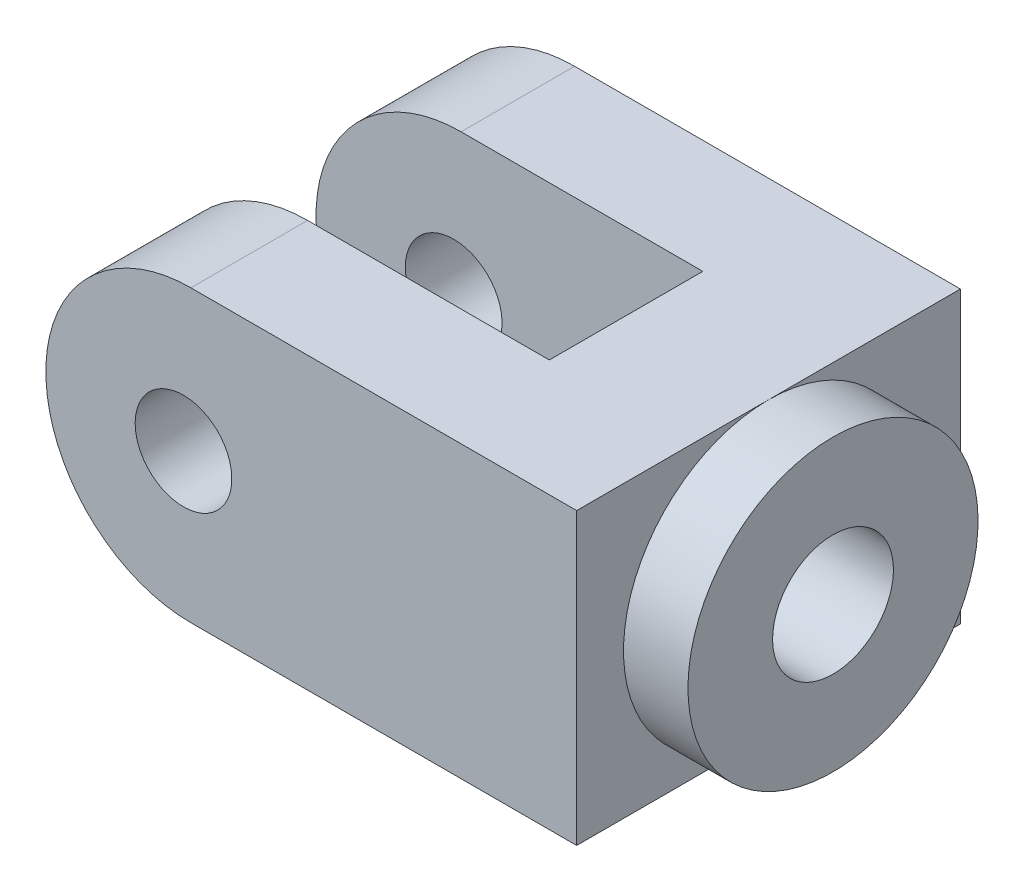
from build123d import *

# Parameters (mm, degrees)
SKETCH1_W           = 132
SKETCH1_H           = 72
BOSS_EXTRUDE1_DEPTH = 47.625
CUT_EXTRUDE1_START  = -95.25
CUT_EXTRUDE1_DEPTH  = 95.25
SKETCH3_W           = 96
SKETCH3_H           = 38.1
CUT_EXTRUDE2_DEPTH  = 109.665268715
SKETCH4_R           = 15
CUT_EXTRUDE3_DEPTH  = 145.656822687
BOSS_EXTRUDE2_START = 16
SKETCH5_R           = 36
SKETCH5_R_2         = 15
BOSS_EXTRUDE2_DEPTH = 16
SKETCH6_R           = 12
CUT_EXTRUDE4_DEPTH  = 131.738527221


# Read off the part's stored shape, not the designer's step: Cut-Extrude1
with BuildPart() as part:
    # Sketch1 → Boss-Extrude1 (new, symmetric)
    with BuildSketch(Plane.XY):
        Rectangle(SKETCH1_W, SKETCH1_H)
    extrude(amount=BOSS_EXTRUDE1_DEPTH, both=True)

    # Cut-Extrude1 outline → Cut-Extrude1 (cut)
    with BuildSketch(Plane.XY.offset(47.625).offset(CUT_EXTRUDE1_START)):
        with BuildLine():
            Line((-66, -36), (-29.762876885, -36))
            ThreePointArc((-29.762876885, -36), (-65.762876885, 0), (-29.762876885, 36))
            Line((-29.762876885, 36), (-66, 36))
            Line((-66, 36), (-66, -36))
        make_face()
    extrude(amount=CUT_EXTRUDE1_DEPTH, mode=Mode.SUBTRACT)

    # Sketch3 → Cut-Extrude2 (cut, through all)
    with BuildSketch(Plane.XZ.offset(36)):
        with Locations((-17.762876885, -0.395)):
            Rectangle(SKETCH3_W, SKETCH3_H)
    extrude(amount=-CUT_EXTRUDE2_DEPTH, mode=Mode.SUBTRACT)

    # Sketch4 → Cut-Extrude3 (cut, through all)
    with BuildSketch(Plane(origin=(66, 0, 0), x_dir=(0, 0, -1), z_dir=(1, 0, 0))):
        with Locations(Location((0, 0, 0), (0, 0, 90))):
            Circle(SKETCH4_R)
    extrude(amount=-CUT_EXTRUDE3_DEPTH, mode=Mode.SUBTRACT)

    # Sketch5 → Boss-Extrude2 (add)
    with BuildSketch(Plane(origin=(66, 0, 0), x_dir=(0, 0, -1), z_dir=(1, 0, 0)).offset(BOSS_EXTRUDE2_START)):
        with Locations(Location((0, 0, 0), (0, 0, 90))):
            Circle(SKETCH5_R)
        with Locations(Location((0, 0, 0), (0, 0, 90))):
            Circle(SKETCH5_R_2, mode=Mode.SUBTRACT)
    extrude(amount=-BOSS_EXTRUDE2_DEPTH)

    # Sketch6 → Cut-Extrude4 (cut, through all)
    with BuildSketch(Plane(origin=(0, 0, -47.625), x_dir=(-1, 0, 0), z_dir=(0, 0, -1))):
        with Locations((31.598726765, 0)):
            Circle(SKETCH6_R)
    extrude(amount=-CUT_EXTRUDE4_DEPTH, mode=Mode.SUBTRACT)


solid = part.part
